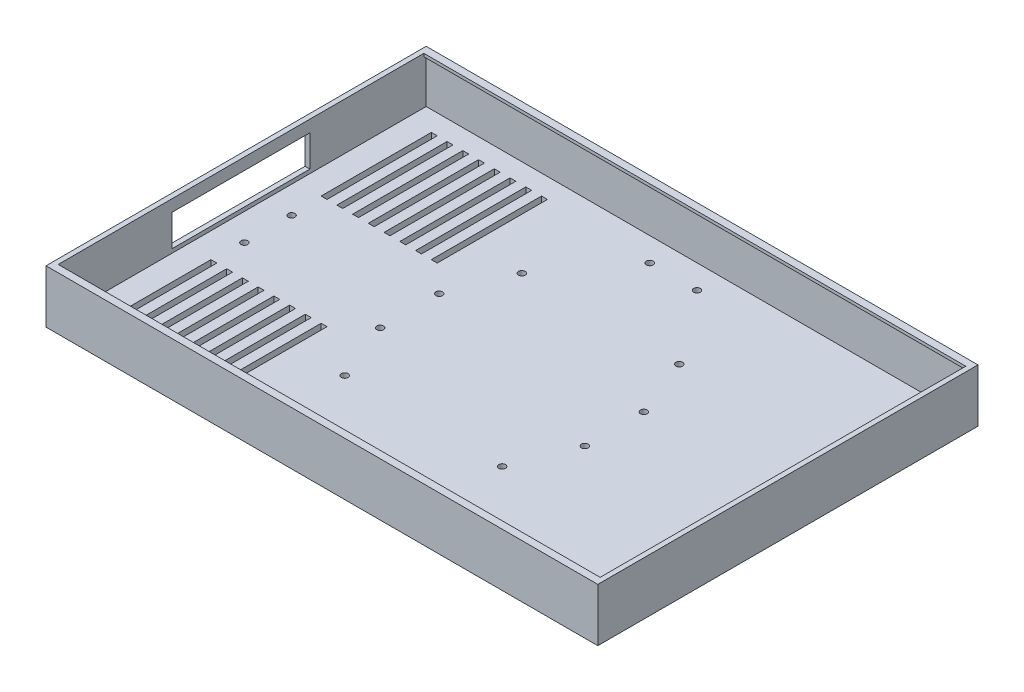
from build123d import *

# Parameters (mm, degrees)
SKETCH1_W                     = 280.4
SKETCH1_H                     = 193.2
SHELL_BLOCK_DEPTH             = 27
SKETCH2_W                     = 275.4
SKETCH2_H                     = 185.8
FRONT_OPENING_DEPTH           = 1.5
SKETCH3_W                     = 275.4
SKETCH3_H                     = 188.2
DISPLAY_POCKET_DEPTH          = 22.5
SKETCH4_W                     = 3
SKETCH4_H                     = 56
VENT_SLOTS_DEPTH              = 4
SKETCH5_W                     = 70
SKETCH5_H                     = 16
CABLE_EXIT_X_SHORT_SIDE_DEPTH = 141.2
SKETCH6_R                     = 1.7
BOLT_HOLES_DEPTH              = 4


with BuildPart() as part:
    # Sketch1 → Shell Block (new body)
    with BuildSketch(Plane(origin=(0, 0, 0), x_dir=(1, 0, 0), z_dir=(0, 1, 0))):
        Rectangle(SKETCH1_W, SKETCH1_H)
    extrude(amount=SHELL_BLOCK_DEPTH)

    # Sketch2 → Front Opening (cut)
    with BuildSketch(Plane(origin=(0, 27, 0), x_dir=(1, 0, 0), z_dir=(0, 1, 0))):
        Rectangle(SKETCH2_W, SKETCH2_H)
    extrude(amount=-FRONT_OPENING_DEPTH, mode=Mode.SUBTRACT)

    # Sketch3 → Display Pocket (cut)
    with BuildSketch(Plane(origin=(0, 25.5, 0), x_dir=(1, 0, 0), z_dir=(0, 1, 0))):
        Rectangle(SKETCH3_W, SKETCH3_H)
    extrude(amount=-DISPLAY_POCKET_DEPTH, mode=Mode.SUBTRACT)

    # Sketch4 → Vent Slots (cut)
    with BuildSketch(Plane(origin=(0, 3, 0), x_dir=(1, 0, 0), z_dir=(0, 1, 0))):
        with Locations((-67.5, 56)):
            Rectangle(SKETCH4_W, SKETCH4_H)
        with Locations((-67.5, -56)):
            Rectangle(SKETCH4_W, SKETCH4_H)
        with Locations((-75.5, 56)):
            Rectangle(SKETCH4_W, SKETCH4_H)
        with Locations((-75.5, -56)):
            Rectangle(SKETCH4_W, SKETCH4_H)
        with Locations((-83.5, 56)):
            Rectangle(SKETCH4_W, SKETCH4_H)
        with Locations((-83.5, -56)):
            Rectangle(SKETCH4_W, SKETCH4_H)
        with Locations((-91.5, 56)):
            Rectangle(SKETCH4_W, SKETCH4_H)
        with Locations((-91.5, -56)):
            Rectangle(SKETCH4_W, SKETCH4_H)
        with Locations((-99.5, 56)):
            Rectangle(SKETCH4_W, SKETCH4_H)
        with Locations((-99.5, -56)):
            Rectangle(SKETCH4_W, SKETCH4_H)
        with Locations((-107.5, 56)):
            Rectangle(SKETCH4_W, SKETCH4_H)
        with Locations((-107.5, -56)):
            Rectangle(SKETCH4_W, SKETCH4_H)
        with Locations((-115.5, 56)):
            Rectangle(SKETCH4_W, SKETCH4_H)
        with Locations((-115.5, -56)):
            Rectangle(SKETCH4_W, SKETCH4_H)
        with Locations((-123.5, 56)):
            Rectangle(SKETCH4_W, SKETCH4_H)
        with Locations((-123.5, -56)):
            Rectangle(SKETCH4_W, SKETCH4_H)
    extrude(amount=-VENT_SLOTS_DEPTH, mode=Mode.SUBTRACT)

    # Sketch5 → Cable Exit (-X short side) (cut)
    with BuildSketch(Plane(origin=(0, 0, 0), x_dir=(0, 0, -1), z_dir=(1, 0, 0))):
        with Locations((0, 13)):
            Rectangle(SKETCH5_W, SKETCH5_H)
    extrude(amount=-CABLE_EXIT_X_SHORT_SIDE_DEPTH, mode=Mode.SUBTRACT)

    # Sketch6 → Bolt Holes (cut)
    with BuildSketch(Plane(origin=(0, 3, 0), x_dir=(1, 0, 0), z_dir=(0, 1, 0))):
        with Locations((-40, -45)):
            Circle(SKETCH6_R)
        with Locations((-40, 45)):
            Circle(SKETCH6_R)
        with Locations((40, -45)):
            Circle(SKETCH6_R)
        with Locations((40, 45)):
            Circle(SKETCH6_R)
        with Locations((-52, -15)):
            Circle(SKETCH6_R)
        with Locations((-52, 15)):
            Circle(SKETCH6_R)
        with Locations((52, -15)):
            Circle(SKETCH6_R)
        with Locations((52, 15)):
            Circle(SKETCH6_R)
        with Locations((-12, -82)):
            Circle(SKETCH6_R)
        with Locations((-12, 82)):
            Circle(SKETCH6_R)
        with Locations((12, -82)):
            Circle(SKETCH6_R)
        with Locations((12, 82)):
            Circle(SKETCH6_R)
        with Locations((-124, -12)):
            Circle(SKETCH6_R)
        with Locations((-124, 12)):
            Circle(SKETCH6_R)
        with Locations((124, -12)):
            Circle(SKETCH6_R)
        with Locations((124, 12)):
            Circle(SKETCH6_R)
    extrude(amount=-BOLT_HOLES_DEPTH, mode=Mode.SUBTRACT)


solid = part.part
